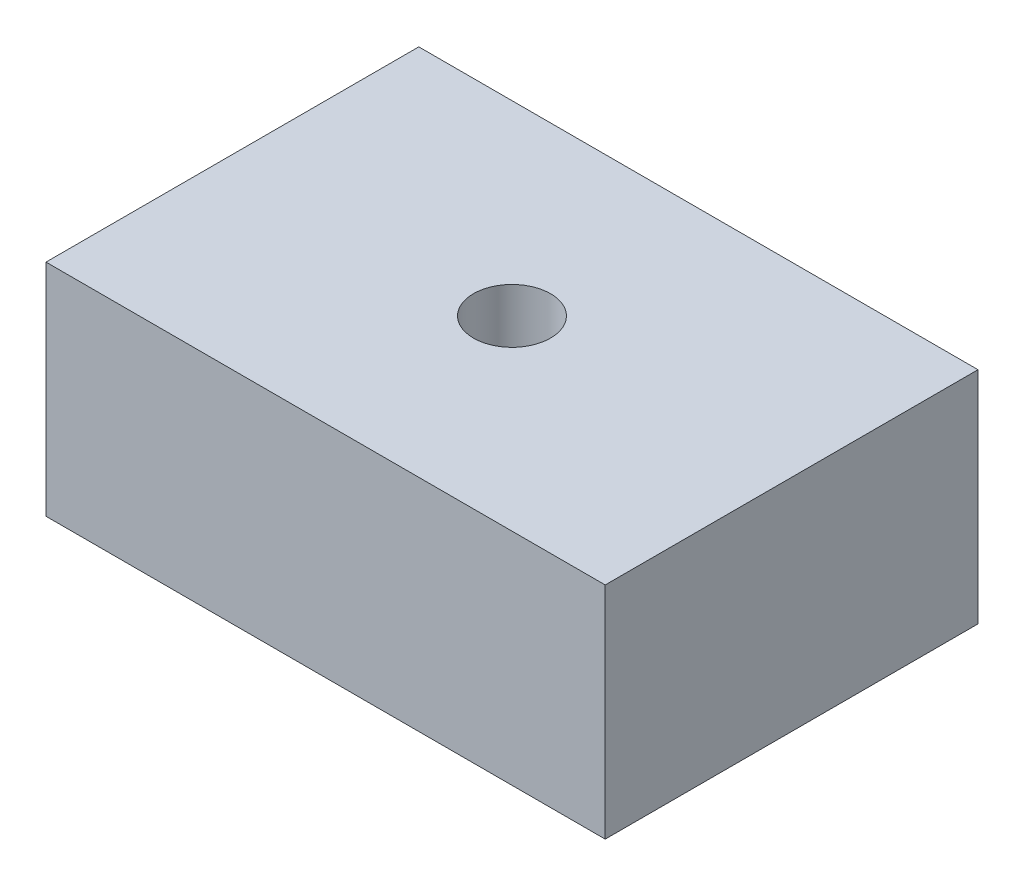
from build123d import *

# Parameters (mm, degrees)
SKETCH1_W           = 76.2
SKETCH1_H           = 50.8
SKETCH1_R           = 5.25
BOSS_EXTRUDE1_DEPTH = 30


with BuildPart() as part:
    # Sketch1 → Boss-Extrude1 (new body)
    with BuildSketch(Plane(origin=(0, 0, 0), x_dir=(1, 0, 0), z_dir=(0, 1, 0))):
        Rectangle(SKETCH1_W, SKETCH1_H)
        Circle(SKETCH1_R, mode=Mode.SUBTRACT)
    extrude(amount=BOSS_EXTRUDE1_DEPTH)


solid = part.part
